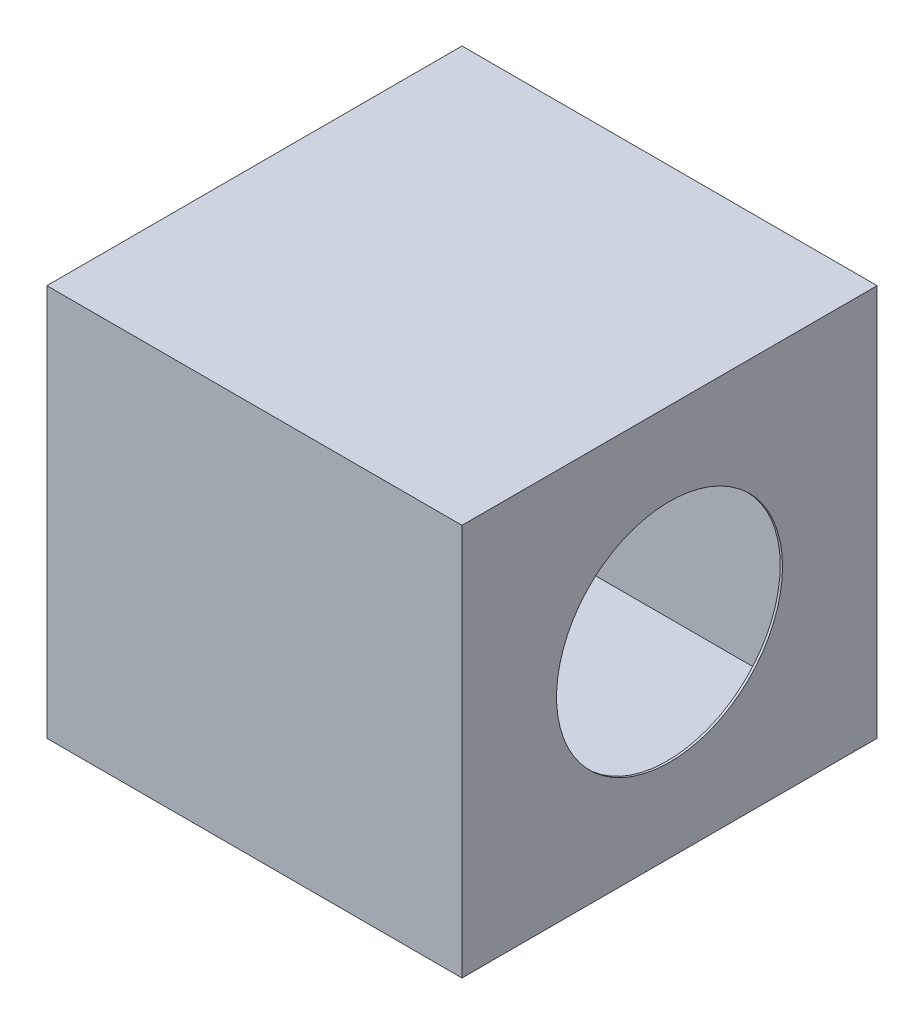
from build123d import *

# Parameters (mm, degrees)
CROQUIS1_W              = 180
CROQUIS1_H              = 170
SALIENTE_EXTRUIR1_DEPTH = 90
CROQUIS2_R              = 49
CORTAR_EXTRUIR1_DEPTH   = 1
CORTAR_EXTRUIR2_START   = -1
CROQUIS3_R              = 49
CORTAR_EXTRUIR2_DEPTH   = 1
VACIADO1_START          = -89
VACIADO1_OUTLINE_W      = 168
VACIADO1_OUTLINE_H      = 178
VACIADO1_DEPTH          = 178


# Read off the part's stored shape, not the designer's step: Vaciado1
with BuildPart() as part:
    # Croquis1 → Saliente-Extruir1 (new, symmetric)
    with BuildSketch(Plane.XY):
        Rectangle(CROQUIS1_W, CROQUIS1_H)
    extrude(amount=SALIENTE_EXTRUIR1_DEPTH, both=True)

    # Croquis2 → Cortar-Extruir1 (cut)
    with BuildSketch(Plane.ZY.offset(90)):
        Circle(CROQUIS2_R)
    extrude(amount=-CORTAR_EXTRUIR1_DEPTH, mode=Mode.SUBTRACT)

    # Croquis3 → Cortar-Extruir2 (cut)
    with BuildSketch(Plane(origin=(90, 0, 0), x_dir=(0, 0, -1), z_dir=(1, 0, 0)).offset(CORTAR_EXTRUIR2_START)):
        with Locations(Location((0, 0, 0), (0, 0, 180))):
            Circle(CROQUIS3_R)
    extrude(amount=CORTAR_EXTRUIR2_DEPTH, mode=Mode.SUBTRACT)

    # Vaciado1 outline → Vaciado1 (cut)
    with BuildSketch(Plane.YZ.offset(VACIADO1_START)):
        Rectangle(VACIADO1_OUTLINE_W, VACIADO1_OUTLINE_H)
    extrude(amount=VACIADO1_DEPTH, mode=Mode.SUBTRACT)


solid = part.part
